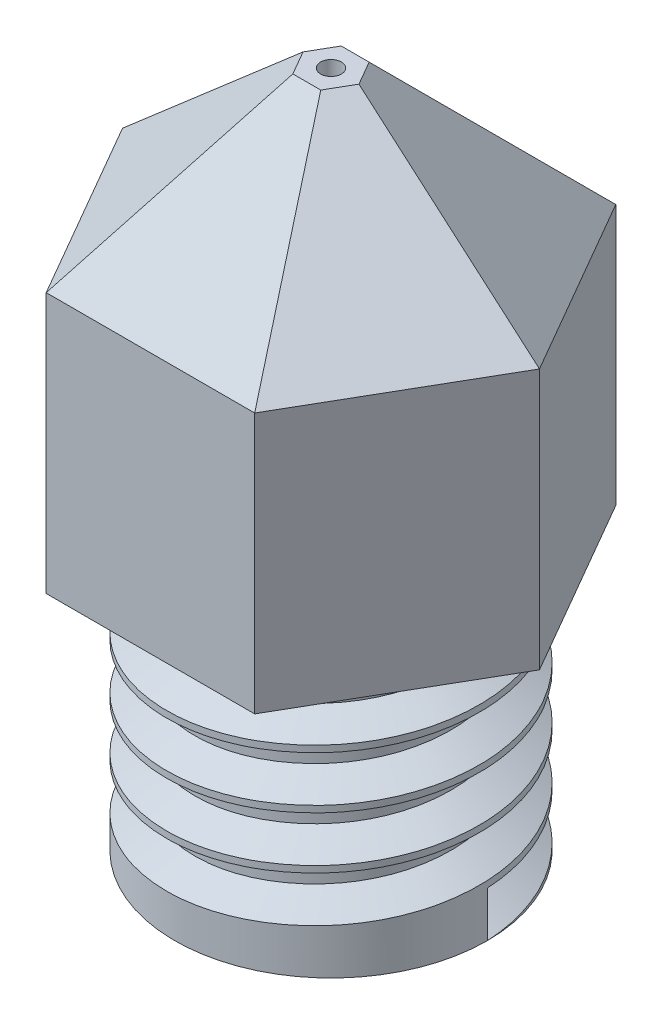
from build123d import *

# Parameters (mm, degrees)
BOSS_EXTRUDE1_DEPTH = 8
CHAMFER1_SIZE       = 3
SKETCH2_R           = 3
BOSS_EXTRUDE2_DEPTH = 5
SKETCH3_R           = 1.5
CUT_EXTRUDE1_DEPTH  = 7
THREAD1_PITCH       = 1
SKETCH8_R           = 0.2
CUT_EXTRUDE2_DEPTH  = 10


with BuildPart() as part:
    # Sketch1 → Boss-Extrude1 (new body)
    with BuildSketch(Plane(origin=(0, 0, 0), x_dir=(1, 0, 0), z_dir=(0, 1, 0))):
        Polygon((4, 0), (2, 3.464101615), (-2, 3.464101615), (-4, 0), (-2, -3.464101615), (2, -3.464101615), align=None)
    extrude(amount=BOSS_EXTRUDE1_DEPTH)

    # Chamfer1
    chamfer1_edges = [part.edges().sort_by_distance(p)[0] for p in [
        (0, 8, -3.464101615),
        (-3, 8, -1.732050808),
        (-3, 8, 1.732050808),
        (0, 8, 3.464101615),
        (3, 8, 1.732050808),
        (3, 8, -1.732050808),
    ]]
    chamfer(chamfer1_edges, length=CHAMFER1_SIZE)

    # Sketch2 → Boss-Extrude2 (add)
    with BuildSketch(Plane.XZ):
        with Locations(Location((0, 0, 0), (0, 0, 270))):
            Circle(SKETCH2_R)
    extrude(amount=BOSS_EXTRUDE2_DEPTH)

    # Sketch3 → Cut-Extrude1 (cut)
    with BuildSketch(Plane.XZ.offset(5)):
        with Locations(Location((0, 0, 0), (0, 0, 270))):
            Circle(SKETCH3_R)
    extrude(amount=-CUT_EXTRUDE1_DEPTH, mode=Mode.SUBTRACT)

    # Thread1: the profile of Thread Profile1 profile screwed along a right-hand helix of 8 turns, 8 arcs to a turn; built about Z, then put on its axis
    thread1_z = Axis((0, 0, 0), (0, 0, 1))
    thread1_corners = [(3.0003, 0, -0.000173205), (3.0003, 0, 0.875173202), (2.458734125, 0, 0.562499999), (2.458734125, 0, 0.312499999)]
    with BuildLine(mode=Mode.PRIVATE) as thread1_profile:
        Line(thread1_corners[0], thread1_corners[1])
        Line(thread1_corners[1], thread1_corners[2])
        Line(thread1_corners[2], thread1_corners[3])
        Line(thread1_corners[3], thread1_corners[0])
    thread1_cap = Face(thread1_profile.wire())
    thread1_turn_angles = [0, 22.5, 45, 67.5, 90, 112.5, 135, 157.5, 180, 202.5, 225, 247.5, 270, 292.5, 315, 337.5, 360]
    thread1_turn_weights = [1, 0.9238795325112867, 1, 0.9238795325112867, 1, 0.9238795325112867, 1, 0.9238795325112867, 1, 0.9238795325112867, 1, 0.9238795325112867, 1, 0.9238795325112867, 1, 0.9238795325112867, 1]
    thread1_turn_rails = [Edge.make_bspline([Vector(p[0], p[1], 0).rotate(thread1_z, thread1_turn_angles[k]) / thread1_turn_weights[k] + Vector(0, 0, p[2] + THREAD1_PITCH * thread1_turn_angles[k] / 360) for k in range(17)], [0, 0, 0, 1, 1, 2, 2, 3, 3, 4, 4, 5, 5, 6, 6, 7, 7, 8, 8, 8], 2, thread1_turn_weights) for p in thread1_corners]
    thread1_turn_sides = [Face.make_surface_from_curves(thread1_turn_rails[p[0]], thread1_turn_rails[p[1]]) for p in [(0, 1), (1, 2), (2, 3), (3, 0)]]
    thread1 = Plane(origin=(0, -5, 0), x_dir=(1, 0, 0), z_dir=(0, 1, 0)) * Solid(Shell([*[p.moved(Location((0, 0, THREAD1_PITCH * i))) for i in range(8) for p in thread1_turn_sides], thread1_cap, thread1_cap.rotate(thread1_z, 2880).moved(Location((0, 0, THREAD1_PITCH * 2880 / 360)))]))
    add(thread1, mode=Mode.SUBTRACT)

    # Sketch8 → Cut-Extrude2 (cut)
    with BuildSketch(Plane(origin=(0, 8, 0), x_dir=(1, 0, 0), z_dir=(0, 1, 0))):
        with Locations(Location((0, 0, 0), (0, 0, 270))):
            Circle(SKETCH8_R)
    extrude(amount=-CUT_EXTRUDE2_DEPTH, mode=Mode.SUBTRACT)


solid = part.part
